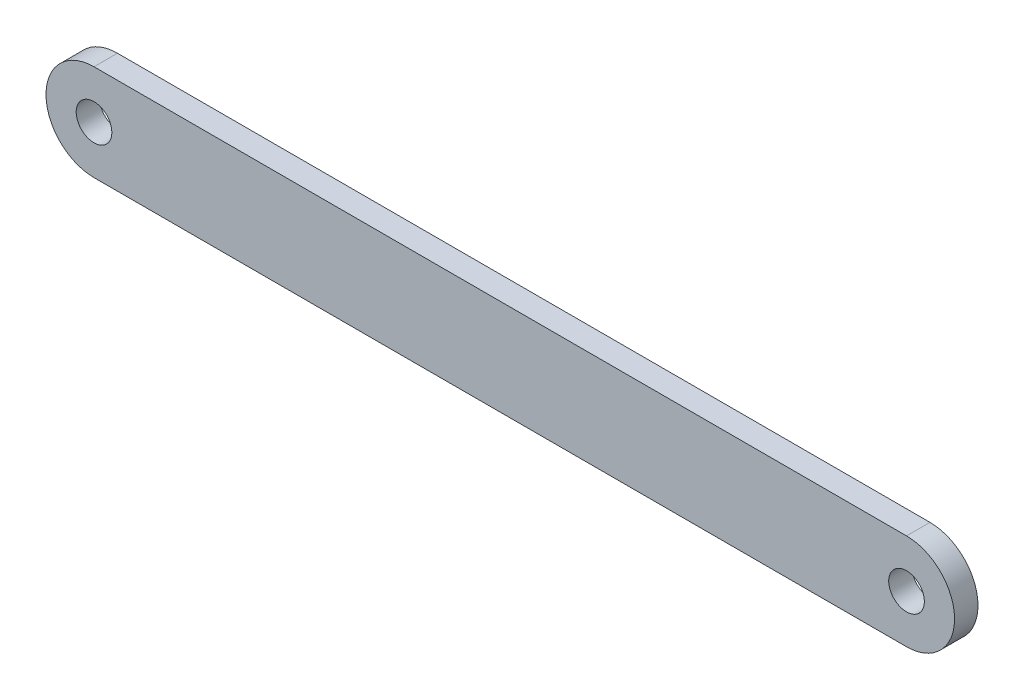
from build123d import *

# Parameters (mm, degrees)
SKETCH1_R           = 2.413
BOSS_EXTRUDE1_DEPTH = 3.175


with BuildPart() as part:
    # Sketch1 → Boss-Extrude1 (new body)
    with BuildSketch(Plane.XY):
        with BuildLine():
            Line((-55, 6.5), (55, 6.5))
            ThreePointArc((55, 6.5), (61.5, 0), (55, -6.5))
            Line((55, -6.5), (-55, -6.5))
            ThreePointArc((-55, -6.5), (-61.5, 0), (-55, 6.5))
        make_face()
        with Locations((-55, 0)):
            Circle(SKETCH1_R, mode=Mode.SUBTRACT)
        with Locations((55, 0)):
            Circle(SKETCH1_R, mode=Mode.SUBTRACT)
    extrude(amount=BOSS_EXTRUDE1_DEPTH)


solid = part.part
